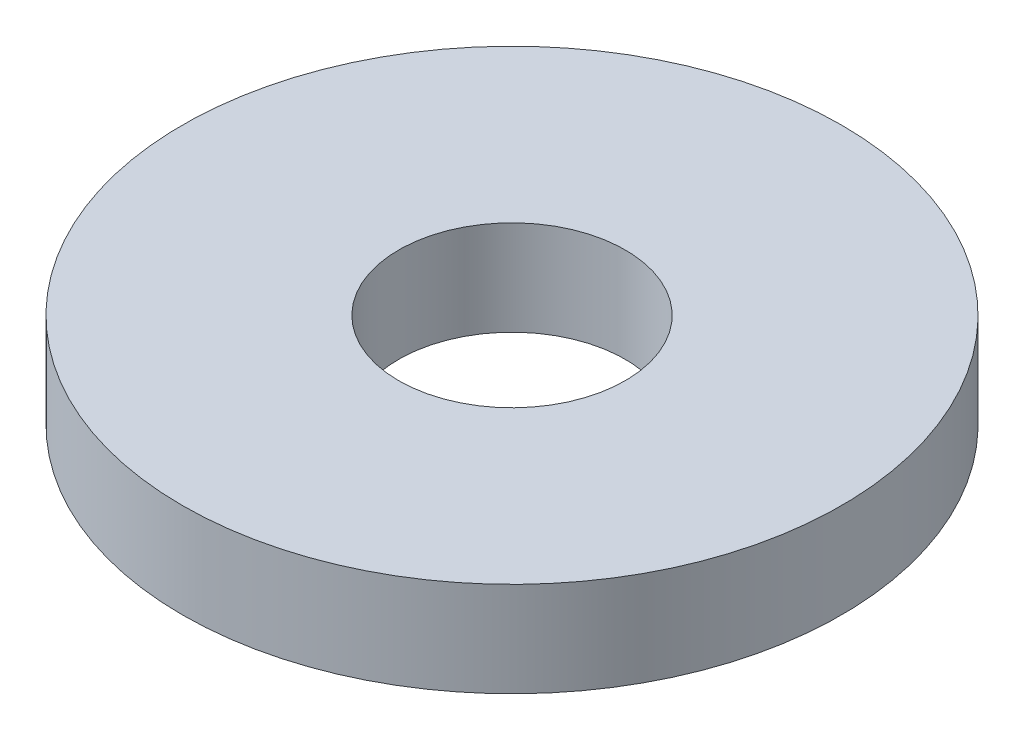
from build123d import *

# Parameters (mm, degrees)
SKETCH1_R           = 80
BOSS_EXTRUDE1_DEPTH = 23
SKETCH2_R           = 27.5
CUT_EXTRUDE1_DEPTH  = 116.451288429


with BuildPart() as part:
    # Sketch1 → Boss-Extrude1 (new body)
    with BuildSketch(Plane(origin=(0, 0, 0), x_dir=(1, 0, 0), z_dir=(0, 1, 0))):
        Circle(SKETCH1_R)
    extrude(amount=BOSS_EXTRUDE1_DEPTH)

    # Sketch2 → Cut-Extrude1 (cut, through all)
    with BuildSketch(Plane(origin=(0, 0, 0), x_dir=(1, 0, 0), z_dir=(0, 1, 0))):
        Circle(SKETCH2_R)
    extrude(amount=CUT_EXTRUDE1_DEPTH, mode=Mode.SUBTRACT)


solid = part.part
